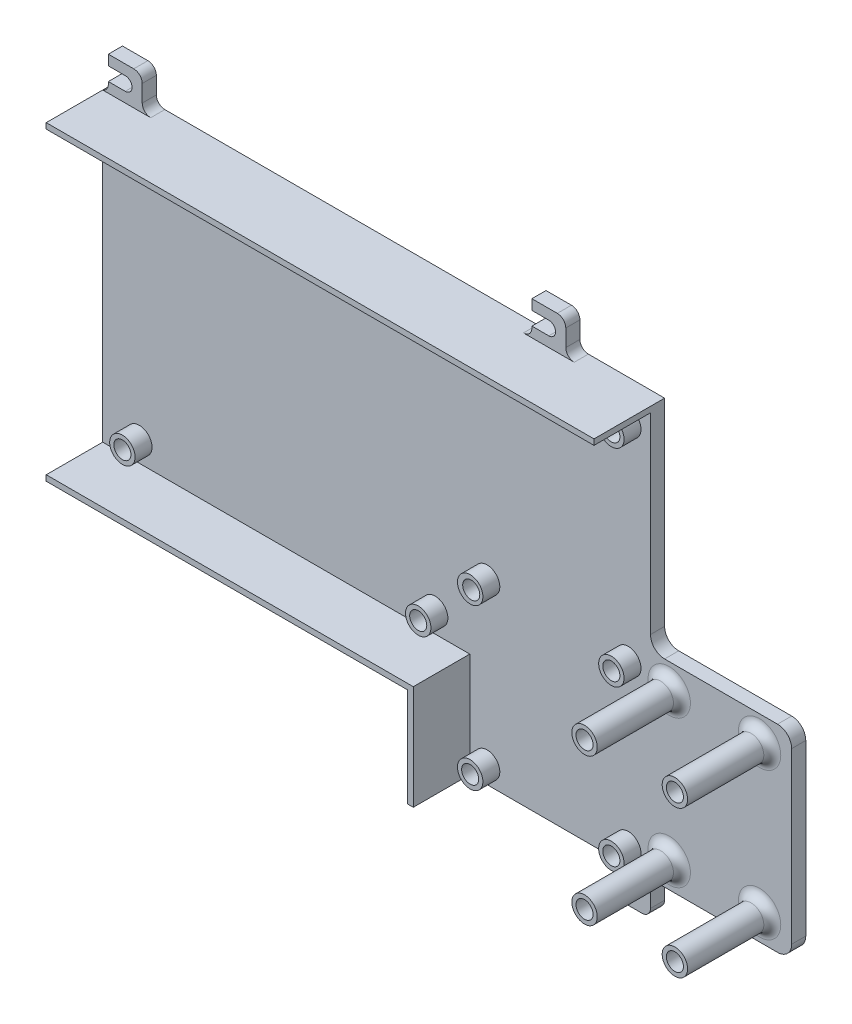
from build123d import *

# Parameters (mm, degrees)
SKETCH1_W            = 128
SKETCH1_H            = 110
SKETCH1_W_2          = 50
SKETCH1_H_2          = 70
BOSS_EXTRUDE1_DEPTH  = 5
SKETCH3_W            = 128
SKETCH3_H            = 2
SKETCH3_W_2          = 194
BOSS_EXTRUDE3_DEPTH  = 20
SKETCH6_W            = 12
SKETCH6_H            = 12
BOSS_EXTRUDE5_DEPTH  = 5
M4_CLEARANCE_HOLE1_D = 4.8
CUT_EXTRUDE1_DEPTH   = 329.83563266
FILLET2_R            = 3
FILLET3_R            = 5
SKETCH15_R           = 4.5
SKETCH15_R_2         = 3.025
BOSS_EXTRUDE6_DEPTH  = 6
SKETCH16_R           = 4.5
SKETCH16_R_2         = 3.025
BOSS_EXTRUDE7_DEPTH  = 30
FILLET4_R            = 3


with BuildPart() as part:
    # Sketch1 → Boss-Extrude1 (new body)
    with BuildSketch(Plane.XY):
        with Locations((-103.32475602, 215.37439567)):
            Rectangle(SKETCH1_W, SKETCH1_H)
        Polygon((26.67524398, 270.37439567), (-39.32475602, 270.37439567), (-39.32475602, 160.37439567), (-39.32475602, 125.37439567), (26.67524398, 125.37439567), (26.67524398, 195.37439567), align=None)
        with Locations((51.67524398, 160.37439567)):
            Rectangle(SKETCH1_W_2, SKETCH1_H_2)
    extrude(amount=BOSS_EXTRUDE1_DEPTH)

    # Sketch3 → Boss-Extrude3 (add)
    with BuildSketch(Plane.XY.offset(5)):
        Polygon((-37.32475602, 162.37439567), (-39.32475602, 162.37439567), (-39.32475602, 160.37439567), (-39.32475602, 125.37439567), (-37.32475602, 125.37439567), align=None)
        with Locations((-103.32475602, 161.37439567)):
            Rectangle(SKETCH3_W, SKETCH3_H)
        with Locations((-70.32475602, 269.37439567)):
            Rectangle(SKETCH3_W_2, SKETCH3_H)
    extrude(amount=BOSS_EXTRUDE3_DEPTH)

    # Sketch6 → Boss-Extrude5 (add)
    with BuildSketch(Plane(origin=(0, 0, 0), x_dir=(-1, 0, 0), z_dir=(0, 0, -1))):
        with Locations((96.32475602, 154.37439567)):
            Rectangle(SKETCH6_W, SKETCH6_H)
        with Locations((159.32475602, 276.37439567)):
            Rectangle(SKETCH6_W, SKETCH6_H)
        with Locations((-20.67524398, 119.37439567)):
            Rectangle(SKETCH6_W, SKETCH6_H)
        with Locations((9.32475602, 276.37439567)):
            Rectangle(SKETCH6_W, SKETCH6_H)
    extrude(amount=-BOSS_EXTRUDE5_DEPTH)

    # M4 Clearance Hole1 (through all)
    with Locations(Plane.XY.offset(5)):
        with Locations((-96.32475602, 154.37439567), (-159.32475602, 276.37439567), (-9.32475602, 276.37439567), (20.67524398, 119.37439567)):
            Hole(M4_CLEARANCE_HOLE1_D / 2)

    # Sketch10 → Cut-Extrude1 (cut, through all)
    with BuildSketch(Plane.XY.offset(5)):
        with BuildLine():
            ThreePointArc((-96.32475602, 151.97439567), (-98.72475602, 154.37439567), (-96.32475602, 156.77439567))
            Line((-96.32475602, 156.77439567), (-102.32475602, 156.77439567))
            Line((-102.32475602, 156.77439567), (-102.32475602, 151.97439567))
            Line((-102.32475602, 151.97439567), (-96.32475602, 151.97439567))
        make_face()
        with BuildLine():
            ThreePointArc((-159.32475602, 273.97439567), (-161.72475602, 276.37439567), (-159.32475602, 278.77439567))
            Line((-159.32475602, 278.77439567), (-165.32475602, 278.77439567))
            Line((-165.32475602, 278.77439567), (-165.32475602, 273.97439567))
            Line((-165.32475602, 273.97439567), (-159.32475602, 273.97439567))
        make_face()
        with BuildLine():
            ThreePointArc((-9.32475602, 273.97439567), (-11.72475602, 276.37439567), (-9.32475602, 278.77439567))
            Line((-9.32475602, 278.77439567), (-15.32475602, 278.77439567))
            Line((-15.32475602, 278.77439567), (-15.32475602, 273.97439567))
            Line((-15.32475602, 273.97439567), (-9.32475602, 273.97439567))
        make_face()
        with BuildLine():
            ThreePointArc((20.67524398, 116.97439567), (18.27524398, 119.37439567), (20.67524398, 121.77439567))
            Line((20.67524398, 121.77439567), (14.67524398, 121.77439567))
            Line((14.67524398, 121.77439567), (14.67524398, 116.97439567))
            Line((14.67524398, 116.97439567), (20.67524398, 116.97439567))
        make_face()
    extrude(amount=-CUT_EXTRUDE1_DEPTH, mode=Mode.SUBTRACT)

    # Fillet2
    # the kernel refuses this fillet: 3 mm, written as the material it adds along each edge
    with BuildSketch(Plane(origin=(-15.32475602, 270.37439567, 0), x_dir=(-1, 0, 0), z_dir=(0, 0, 1)), Plane(origin=(-90.32475602, 160.37439567, 0), x_dir=(1, 0, 0), z_dir=(0, 0, 1))) as fillet2_piece_1:
        with BuildLine():
            CenterArc((FILLET2_R, -FILLET2_R), FILLET2_R, 90, 90)
            Line((0, -FILLET2_R), (0, 0))
            Line((0, 0), (FILLET2_R, 0))
        make_face()
    extrude(amount=5)
    with BuildSketch(Plane(origin=(-3.32475602, 270.37439567, 0), x_dir=(1, 0, 0), z_dir=(0, 0, 1)), Plane(origin=(-102.32475602, 160.37439567, 0), x_dir=(-1, 0, 0), z_dir=(0, 0, 1)), Plane(origin=(-153.32475602, 270.37439567, 0), x_dir=(1, 0, 0), z_dir=(0, 0, 1)), Plane(origin=(14.67524398, 125.37439567, 0), x_dir=(-1, 0, 0), z_dir=(0, 0, 1)), Plane(origin=(26.67524398, 125.37439567, 0), x_dir=(0, -1, 0), z_dir=(0, 0, 1))) as fillet2_piece_2:
        with BuildLine():
            CenterArc((FILLET2_R, FILLET2_R), FILLET2_R, 180, 90)
            Line((0, FILLET2_R), (0, 0))
            Line((0, 0), (FILLET2_R, 0))
        make_face()
    extrude(amount=5)
    with BuildSketch(Plane(origin=(-165.32475602, 270.37439567, 0), x_dir=(-1, 0, 0), z_dir=(0, 0, 1))) as fillet2_piece_3:
        with BuildLine():
            CenterArc((3, -2.828427125), FILLET2_R, 109.471220634, 70.528779366)
            Line((0, -2.828427125), (0, 0))
            Line((0, 0), (2, 0))
        make_face()
    extrude(amount=5)
    # the kernel refuses this fillet: 3 mm, written as the material it takes off along each edge
    with BuildSketch(Plane(origin=(-3.32475602, 282.37439567, -7.5), x_dir=(-1, 0, 0), z_dir=(0, 0, 1)), Plane(origin=(-90.32475602, 148.37439567, -7.5), x_dir=(0, 1, 0), z_dir=(0, 0, 1)), Plane(origin=(-153.32475602, 282.37439567, -7.5), x_dir=(-1, 0, 0), z_dir=(0, 0, 1)), Plane(origin=(26.67524398, 113.37439567, -7.5), x_dir=(0, 1, 0), z_dir=(0, 0, 1))) as fillet2_2_piece_1:
        with BuildLine():
            CenterArc((FILLET2_R, FILLET2_R), FILLET2_R, 180, 90)
            Line((0, FILLET2_R), (0, 0))
            Line((0, 0), (FILLET2_R, 0))
        make_face()
    extrude(amount=20, mode=Mode.SUBTRACT)

    # Fillet3
    fillet3_edges = [part.edges().sort_by_distance(p)[0] for p in [
        (26.67524398, 195.37439567, 2.5),
        (76.67524398, 195.37439567, 2.5),
        (76.67524398, 125.37439567, 2.5),
    ]]
    fillet(fillet3_edges, radius=FILLET3_R)

    # Sketch15 → Boss-Extrude6 (add)
    # profile 1 of 10: a face of its own
    with BuildSketch(Plane.XY.offset(5)):
        with Locations((-154.35475602, 169.52739567)):
            Circle(SKETCH15_R)
        with Locations((-154.35475602, 169.52739567)):
            Circle(SKETCH15_R_2, mode=Mode.SUBTRACT)
    # profile 2 of 10: a face of its own
    with BuildSketch(Plane.XY.offset(5)):
        with Locations((-49.57975602, 262.49139567)):
            Circle(SKETCH15_R)
        with Locations((-49.57975602, 262.49139567)):
            Circle(SKETCH15_R_2, mode=Mode.SUBTRACT)
    # profile 3 of 10: a face of its own
    with BuildSketch(Plane.XY.offset(5)):
        with Locations((-49.57975602, 169.52739567)):
            Circle(SKETCH15_R)
        with Locations((-49.57975602, 169.52739567)):
            Circle(SKETCH15_R_2, mode=Mode.SUBTRACT)
    # profile 4 of 10: a face of its own
    with BuildSketch(Plane.XY.offset(5)):
        with Locations((-31.18175602, 131.55539567)):
            Circle(SKETCH15_R)
        with Locations((-31.18175602, 131.55539567)):
            Circle(SKETCH15_R_2, mode=Mode.SUBTRACT)
    # profile 5 of 10: a face of its own
    with BuildSketch(Plane.XY.offset(5)):
        with Locations((-31.18175602, 188.30539567)):
            Circle(SKETCH15_R)
        with Locations((-30.807769142, 188.30539567)):
            Circle(SKETCH15_R_2, mode=Mode.SUBTRACT)
    # profile 6 of 10: a face of its own
    with BuildSketch(Plane.XY.offset(5)):
        with Locations((18.81824398, 188.30539567)):
            Circle(SKETCH15_R)
        with Locations((18.81824398, 188.30539567)):
            Circle(SKETCH15_R_2, mode=Mode.SUBTRACT)
    # profile 7 of 10: a face of its own
    with BuildSketch(Plane.XY.offset(5)):
        with Locations((18.81824398, 131.55539567)):
            Circle(SKETCH15_R)
        with Locations((18.81824398, 131.55539567)):
            Circle(SKETCH15_R_2, mode=Mode.SUBTRACT)
    # profile 8 of 10: a face of its own
    with BuildSketch(Plane.XY.offset(5)):
        with Locations((-31.18175602, 261.55539567)):
            Circle(SKETCH15_R)
        with Locations((-31.18175602, 261.55539567)):
            Circle(SKETCH15_R_2, mode=Mode.SUBTRACT)
    # profile 9 of 10: a face of its own
    with BuildSketch(Plane.XY.offset(5)):
        with Locations((18.81824398, 261.55539567)):
            Circle(SKETCH15_R)
        with Locations((18.81824398, 261.55539567)):
            Circle(SKETCH15_R_2, mode=Mode.SUBTRACT)
    # profile 10 of 10: a face of its own
    with BuildSketch(Plane.XY.offset(5)):
        with Locations((-154.35475602, 262.49139567)):
            Circle(SKETCH15_R)
        with Locations((-154.35475602, 262.49139567)):
            Circle(SKETCH15_R_2, mode=Mode.SUBTRACT)
    extrude(amount=BOSS_EXTRUDE6_DEPTH)

    # Sketch16 → Boss-Extrude7 (add)
    # profile 1 of 4: a face of its own
    with BuildSketch(Plane.XY.offset(5)):
        with Locations((33.31824398, 134.37439567)):
            Circle(SKETCH16_R)
        with Locations((33.31824398, 134.37439567)):
            Circle(SKETCH16_R_2, mode=Mode.SUBTRACT)
    # profile 2 of 4: a face of its own
    with BuildSketch(Plane.XY.offset(5)):
        with Locations((65.31824398, 134.37439567)):
            Circle(SKETCH16_R)
        with Locations((65.31824398, 134.37439567)):
            Circle(SKETCH16_R_2, mode=Mode.SUBTRACT)
    # profile 3 of 4: a face of its own
    with BuildSketch(Plane.XY.offset(5)):
        with Locations((65.31824398, 186.37439567)):
            Circle(SKETCH16_R)
        with Locations((65.31824398, 186.37439567)):
            Circle(SKETCH16_R_2, mode=Mode.SUBTRACT)
    # profile 4 of 4: a face of its own
    with BuildSketch(Plane.XY.offset(5)):
        with Locations((33.31824398, 186.37439567)):
            Circle(SKETCH16_R)
        with Locations((33.31824398, 186.37439567)):
            Circle(SKETCH16_R_2, mode=Mode.SUBTRACT)
    extrude(amount=BOSS_EXTRUDE7_DEPTH)

    # Fillet4
    fillet4_edges = [part.edges().sort_by_distance(p)[0] for p in [
        (28.81824398, 134.37439567, 5),
        (60.81824398, 134.37439567, 5),
        (60.81824398, 186.37439567, 5),
        (28.81824398, 186.37439567, 5),
    ]]
    fillet(fillet4_edges, radius=FILLET4_R)


solid = part.part
